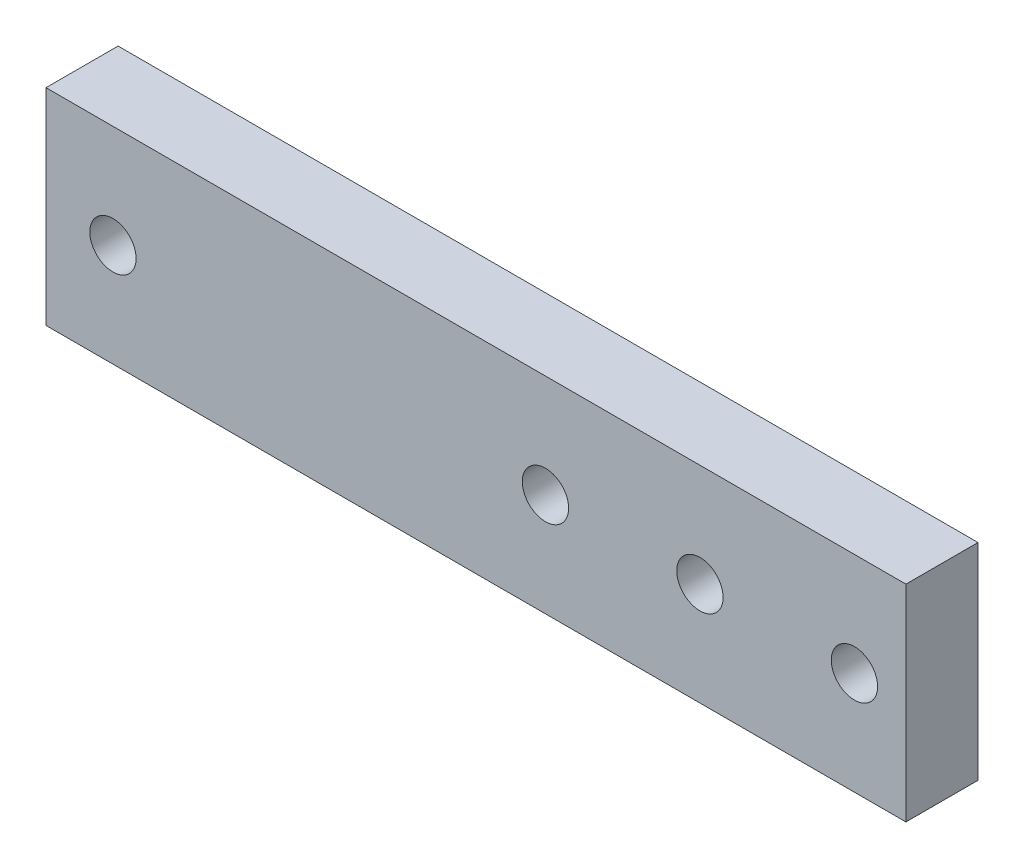
from build123d import *

# Parameters (mm, degrees)
SKETCH1_W           = 83.5
SKETCH1_H           = 20
SKETCH1_R           = 2.25
BOSS_EXTRUDE1_DEPTH = 7


with BuildPart() as part:
    # Sketch1 → Boss-Extrude1 (new body)
    with BuildSketch(Plane.XY):
        Rectangle(SKETCH1_W, SKETCH1_H)
        with Locations((6.75, 0)):
            Circle(SKETCH1_R, mode=Mode.SUBTRACT)
        with Locations((-35.25, 0)):
            Circle(SKETCH1_R, mode=Mode.SUBTRACT)
        with Locations((21.75, 0)):
            Circle(SKETCH1_R, mode=Mode.SUBTRACT)
        with Locations((36.75, 0)):
            Circle(SKETCH1_R, mode=Mode.SUBTRACT)
    extrude(amount=BOSS_EXTRUDE1_DEPTH)


solid = part.part
